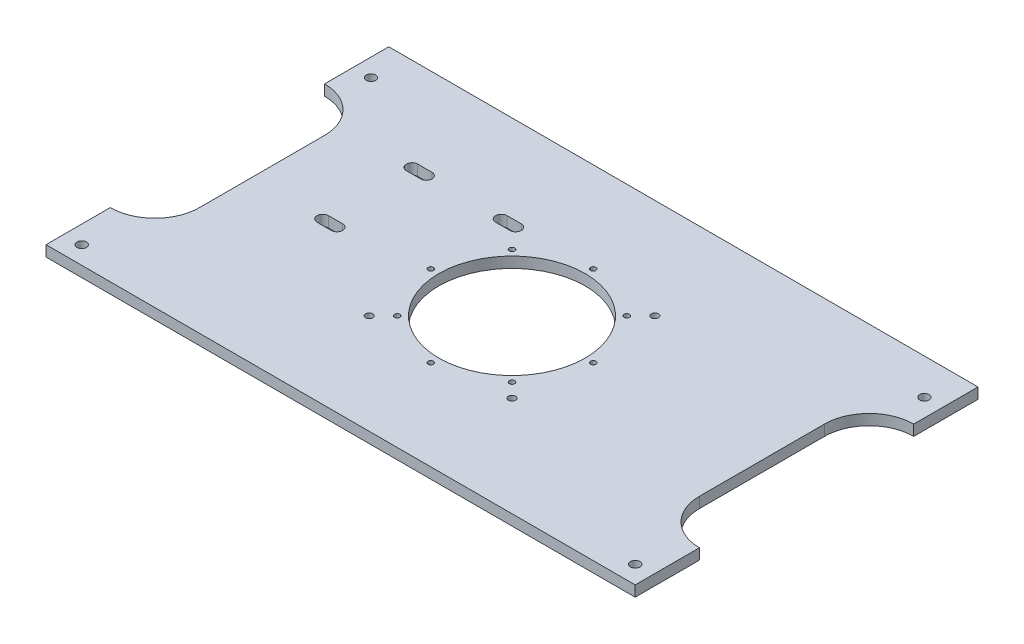
from build123d import *

# Parameters (mm, degrees)
SKETCH1_W                = 330
SKETCH1_H                = 192
BOSS_EXTRUDE1_DEPTH      = 6
CUT_EXTRUDE1_DEPTH       = 382.837661841
CUT_EXTRUDE1_DEPTH_BACK  = 382.837661841
SKETCH2_R                = 1.5
SKETCH3_R                = 41
CUT_EXTRUDE2_DEPTH       = 382.837661841
CUT_EXTRUDE5_DEPTH       = 10
SKETCH11_R               = 2
CUT_EXTRUDE6_DEPTH       = 10
M5_CLEARANCE_HOLE1_D     = 5.3
M5_CLEARANCE_HOLE1_DEPTH = 11.94
M5_CLEARANCE_HOLE1_TIP   = 1.59228064
CUT_EXTRUDE10_DEPTH      = 382.837661841


with BuildPart() as part:
    # Sketch1 → Boss-Extrude1 (new body)
    with BuildSketch(Plane(origin=(0, 0, 0), x_dir=(1, 0, 0), z_dir=(0, 1, 0))):
        with Locations((165, 96)):
            Rectangle(SKETCH1_W, SKETCH1_H)
    extrude(amount=BOSS_EXTRUDE1_DEPTH)

    # Sketch2 → Cut-Extrude1 (cut, two sides: drawn at the far end of the back side and taken through both)
    with BuildSketch(Plane(origin=(0, 6, 0), x_dir=(1, 0, 0), z_dir=(0, 1, 0)).offset(-CUT_EXTRUDE1_DEPTH_BACK)):
        with Locations((165, 141.5)):
            Circle(SKETCH2_R)
        with Locations((197.173358544, 128.173358544)):
            Circle(SKETCH2_R)
        with Locations((210.5, 96)):
            Circle(SKETCH2_R)
        with Locations((197.173358544, 63.826641456)):
            Circle(SKETCH2_R)
        with Locations((165, 50.5)):
            Circle(SKETCH2_R)
        with Locations((132.826641456, 63.826641456)):
            Circle(SKETCH2_R)
        with Locations((119.5, 96)):
            Circle(SKETCH2_R)
        with Locations((132.826641456, 128.173358544)):
            Circle(SKETCH2_R)
    extrude(amount=CUT_EXTRUDE1_DEPTH + CUT_EXTRUDE1_DEPTH_BACK, mode=Mode.SUBTRACT)

    # Sketch3 → Cut-Extrude2 (cut, through all)
    with BuildSketch(Plane(origin=(0, 6, 0), x_dir=(1, 0, 0), z_dir=(0, 1, 0))):
        with Locations((165, 96)):
            Circle(SKETCH3_R)
    extrude(amount=-CUT_EXTRUDE2_DEPTH, mode=Mode.SUBTRACT)

    # Sketch10 → Cut-Extrude5 (cut)
    with BuildSketch(Plane.XZ):
        with BuildLine():
            Line((65, -93.2), (73, -93.2))
            ThreePointArc((73, -93.2), (76.2, -90), (73, -86.8))
            Line((73, -86.8), (65, -86.8))
            ThreePointArc((65, -86.8), (61.8, -90), (65, -93.2))
        make_face()
        with BuildLine():
            Line((65, -143.2), (73, -143.2))
            ThreePointArc((73, -143.2), (76.2, -140), (73, -136.8))
            Line((73, -136.8), (65, -136.8))
            ThreePointArc((65, -136.8), (61.8, -140), (65, -143.2))
        make_face()
        with BuildLine():
            Line((115, -143.2), (123, -143.2))
            ThreePointArc((123, -143.2), (126.2, -140), (123, -136.8))
            Line((123, -136.8), (115, -136.8))
            ThreePointArc((115, -136.8), (111.8, -140), (115, -143.2))
        make_face()
    extrude(amount=-CUT_EXTRUDE5_DEPTH, mode=Mode.SUBTRACT)

    # Sketch11 → Cut-Extrude6 (cut)
    with BuildSketch(Plane.XZ):
        with Locations((205, -56)):
            Circle(SKETCH11_R)
        with Locations((125, -56)):
            Circle(SKETCH11_R)
        with Locations((205, -136)):
            Circle(SKETCH11_R)
    extrude(amount=-CUT_EXTRUDE6_DEPTH, mode=Mode.SUBTRACT)

    # M5 Clearance Hole1
    with Locations(Plane(origin=(0, 6, 0), x_dir=(1, 0, 0), z_dir=(0, 1, 0))):
        with Locations((10, 172), (10, 10), (320, 10), (320, 172)):
            Hole(M5_CLEARANCE_HOLE1_D / 2, depth=M5_CLEARANCE_HOLE1_DEPTH)
            with Locations((0, 0, -(M5_CLEARANCE_HOLE1_DEPTH + M5_CLEARANCE_HOLE1_TIP / 2))):  # 118° drill point
                Cone(0, M5_CLEARANCE_HOLE1_D / 2, M5_CLEARANCE_HOLE1_TIP, mode=Mode.SUBTRACT)

    # Sketch19 → Cut-Extrude10 (cut, through all)
    with BuildSketch(Plane(origin=(0, 6, 0), x_dir=(1, 0, 0), z_dir=(0, 1, 0))):
        with BuildLine():
            Line((25, 131), (25, 61))
            ThreePointArc((25, 61), (0, 36), (-25, 61))
            Line((-25, 61), (-25, 131))
            ThreePointArc((-25, 131), (0, 156), (25, 131))
        make_face()
        with BuildLine():
            Line((305, 131), (305, 61))
            ThreePointArc((305, 61), (330, 36), (355, 61))
            Line((355, 61), (355, 131))
            ThreePointArc((355, 131), (330, 156), (305, 131))
        make_face()
    extrude(amount=-CUT_EXTRUDE10_DEPTH, mode=Mode.SUBTRACT)


solid = part.part
